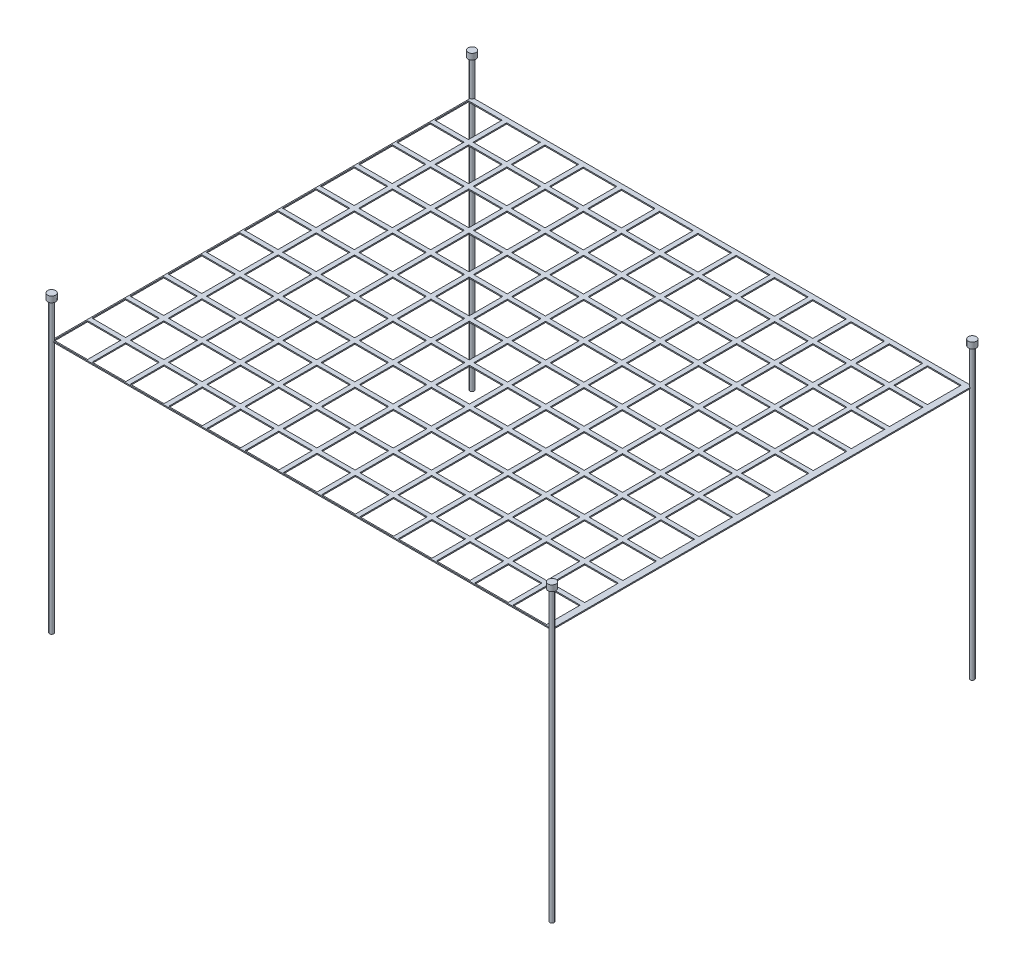
from build123d import *

# Parameters (mm, degrees)
CROQUIS1_W                 = 5950
CROQUIS1_H                 = 5000
SALIENTE_EXTRUIR1_DEPTH    = 13.32
CROQUIS2_W                 = 400
CROQUIS2_H                 = 400
CORTAR_EXTRUIR1_DEPTH      = 34
MATRIZL1_COUNT             = 11
MATRIZL1_PITCH             = 453
MATRIZL2_COPY_1_SKETCH_W   = 400
MATRIZL2_COPY_1_SKETCH_H   = 400
MATRIZL2_COPY_1_DEPTH      = 34
MATRIZL2_COPY_2_SKETCH_W   = 400
MATRIZL2_COPY_2_SKETCH_H   = 400
MATRIZL2_COPY_2_DEPTH      = 34
MATRIZL2_COPY_3_SKETCH_W   = 400
MATRIZL2_COPY_3_SKETCH_H   = 400
MATRIZL2_COPY_3_DEPTH      = 34
MATRIZL2_COPY_4_SKETCH_W   = 400
MATRIZL2_COPY_4_SKETCH_H   = 400
MATRIZL2_COPY_4_DEPTH      = 34
MATRIZL2_COPY_5_SKETCH_W   = 400
MATRIZL2_COPY_5_SKETCH_H   = 400
MATRIZL2_COPY_5_DEPTH      = 34
MATRIZL2_COPY_6_SKETCH_W   = 400
MATRIZL2_COPY_6_SKETCH_H   = 400
MATRIZL2_COPY_6_DEPTH      = 34
MATRIZL2_COPY_7_SKETCH_W   = 400
MATRIZL2_COPY_7_SKETCH_H   = 400
MATRIZL2_COPY_7_DEPTH      = 34
MATRIZL2_COPY_8_SKETCH_W   = 400
MATRIZL2_COPY_8_SKETCH_H   = 400
MATRIZL2_COPY_8_DEPTH      = 34
MATRIZL2_COPY_9_SKETCH_W   = 400
MATRIZL2_COPY_9_SKETCH_H   = 400
MATRIZL2_COPY_9_DEPTH      = 34
MATRIZL2_COPY_10_SKETCH_W  = 400
MATRIZL2_COPY_10_SKETCH_H  = 400
MATRIZL2_COPY_10_DEPTH     = 34
MATRIZL2_COPY_11_SKETCH_W  = 400
MATRIZL2_COPY_11_SKETCH_H  = 400
MATRIZL2_COPY_11_DEPTH     = 34
MATRIZL2_COPY_12_SKETCH_W  = 400
MATRIZL2_COPY_12_SKETCH_H  = 400
MATRIZL2_COPY_12_DEPTH     = 34
MATRIZL2_COPY_13_SKETCH_W  = 400
MATRIZL2_COPY_13_SKETCH_H  = 400
MATRIZL2_COPY_13_DEPTH     = 34
MATRIZL2_COPY_14_SKETCH_W  = 400
MATRIZL2_COPY_14_SKETCH_H  = 400
MATRIZL2_COPY_14_DEPTH     = 34
MATRIZL2_COPY_15_SKETCH_W  = 400
MATRIZL2_COPY_15_SKETCH_H  = 400
MATRIZL2_COPY_15_DEPTH     = 34
MATRIZL2_COPY_16_SKETCH_W  = 400
MATRIZL2_COPY_16_SKETCH_H  = 400
MATRIZL2_COPY_16_DEPTH     = 34
MATRIZL2_COPY_17_SKETCH_W  = 400
MATRIZL2_COPY_17_SKETCH_H  = 400
MATRIZL2_COPY_17_DEPTH     = 34
MATRIZL2_COPY_18_SKETCH_W  = 400
MATRIZL2_COPY_18_SKETCH_H  = 400
MATRIZL2_COPY_18_DEPTH     = 34
MATRIZL2_COPY_19_SKETCH_W  = 400
MATRIZL2_COPY_19_SKETCH_H  = 400
MATRIZL2_COPY_19_DEPTH     = 34
MATRIZL2_COPY_20_SKETCH_W  = 400
MATRIZL2_COPY_20_SKETCH_H  = 400
MATRIZL2_COPY_20_DEPTH     = 34
MATRIZL2_COPY_21_SKETCH_W  = 400
MATRIZL2_COPY_21_SKETCH_H  = 400
MATRIZL2_COPY_21_DEPTH     = 34
MATRIZL2_COPY_22_SKETCH_W  = 400
MATRIZL2_COPY_22_SKETCH_H  = 400
MATRIZL2_COPY_22_DEPTH     = 34
MATRIZL2_COPY_23_SKETCH_W  = 400
MATRIZL2_COPY_23_SKETCH_H  = 400
MATRIZL2_COPY_23_DEPTH     = 34
MATRIZL2_COPY_24_SKETCH_W  = 400
MATRIZL2_COPY_24_SKETCH_H  = 400
MATRIZL2_COPY_24_DEPTH     = 34
MATRIZL2_COPY_25_SKETCH_W  = 400
MATRIZL2_COPY_25_SKETCH_H  = 400
MATRIZL2_COPY_25_DEPTH     = 34
MATRIZL2_COPY_26_SKETCH_W  = 400
MATRIZL2_COPY_26_SKETCH_H  = 400
MATRIZL2_COPY_26_DEPTH     = 34
MATRIZL2_COPY_27_SKETCH_W  = 400
MATRIZL2_COPY_27_SKETCH_H  = 400
MATRIZL2_COPY_27_DEPTH     = 34
MATRIZL2_COPY_28_SKETCH_W  = 400
MATRIZL2_COPY_28_SKETCH_H  = 400
MATRIZL2_COPY_28_DEPTH     = 34
MATRIZL2_COPY_29_SKETCH_W  = 400
MATRIZL2_COPY_29_SKETCH_H  = 400
MATRIZL2_COPY_29_DEPTH     = 34
MATRIZL2_COPY_30_SKETCH_W  = 400
MATRIZL2_COPY_30_SKETCH_H  = 400
MATRIZL2_COPY_30_DEPTH     = 34
MATRIZL2_COPY_31_SKETCH_W  = 400
MATRIZL2_COPY_31_SKETCH_H  = 400
MATRIZL2_COPY_31_DEPTH     = 34
MATRIZL2_COPY_32_SKETCH_W  = 400
MATRIZL2_COPY_32_SKETCH_H  = 400
MATRIZL2_COPY_32_DEPTH     = 34
MATRIZL2_COPY_33_SKETCH_W  = 400
MATRIZL2_COPY_33_SKETCH_H  = 400
MATRIZL2_COPY_33_DEPTH     = 34
MATRIZL2_COPY_34_SKETCH_W  = 400
MATRIZL2_COPY_34_SKETCH_H  = 400
MATRIZL2_COPY_34_DEPTH     = 34
MATRIZL2_COPY_35_SKETCH_W  = 400
MATRIZL2_COPY_35_SKETCH_H  = 400
MATRIZL2_COPY_35_DEPTH     = 34
MATRIZL2_COPY_36_SKETCH_W  = 400
MATRIZL2_COPY_36_SKETCH_H  = 400
MATRIZL2_COPY_36_DEPTH     = 34
MATRIZL2_COPY_37_SKETCH_W  = 400
MATRIZL2_COPY_37_SKETCH_H  = 400
MATRIZL2_COPY_37_DEPTH     = 34
MATRIZL2_COPY_38_SKETCH_W  = 400
MATRIZL2_COPY_38_SKETCH_H  = 400
MATRIZL2_COPY_38_DEPTH     = 34
MATRIZL2_COPY_39_SKETCH_W  = 400
MATRIZL2_COPY_39_SKETCH_H  = 400
MATRIZL2_COPY_39_DEPTH     = 34
MATRIZL2_COPY_40_SKETCH_W  = 400
MATRIZL2_COPY_40_SKETCH_H  = 400
MATRIZL2_COPY_40_DEPTH     = 34
MATRIZL2_COPY_41_SKETCH_W  = 400
MATRIZL2_COPY_41_SKETCH_H  = 400
MATRIZL2_COPY_41_DEPTH     = 34
MATRIZL2_COPY_42_SKETCH_W  = 400
MATRIZL2_COPY_42_SKETCH_H  = 400
MATRIZL2_COPY_42_DEPTH     = 34
MATRIZL2_COPY_43_SKETCH_W  = 400
MATRIZL2_COPY_43_SKETCH_H  = 400
MATRIZL2_COPY_43_DEPTH     = 34
MATRIZL2_COPY_44_SKETCH_W  = 400
MATRIZL2_COPY_44_SKETCH_H  = 400
MATRIZL2_COPY_44_DEPTH     = 34
MATRIZL2_COPY_45_SKETCH_W  = 400
MATRIZL2_COPY_45_SKETCH_H  = 400
MATRIZL2_COPY_45_DEPTH     = 34
MATRIZL2_COPY_46_SKETCH_W  = 400
MATRIZL2_COPY_46_SKETCH_H  = 400
MATRIZL2_COPY_46_DEPTH     = 34
MATRIZL2_COPY_47_SKETCH_W  = 400
MATRIZL2_COPY_47_SKETCH_H  = 400
MATRIZL2_COPY_47_DEPTH     = 34
MATRIZL2_COPY_48_SKETCH_W  = 400
MATRIZL2_COPY_48_SKETCH_H  = 400
MATRIZL2_COPY_48_DEPTH     = 34
MATRIZL2_COPY_49_SKETCH_W  = 400
MATRIZL2_COPY_49_SKETCH_H  = 400
MATRIZL2_COPY_49_DEPTH     = 34
MATRIZL2_COPY_50_SKETCH_W  = 400
MATRIZL2_COPY_50_SKETCH_H  = 400
MATRIZL2_COPY_50_DEPTH     = 34
MATRIZL2_COPY_51_SKETCH_W  = 400
MATRIZL2_COPY_51_SKETCH_H  = 400
MATRIZL2_COPY_51_DEPTH     = 34
MATRIZL2_COPY_52_SKETCH_W  = 400
MATRIZL2_COPY_52_SKETCH_H  = 400
MATRIZL2_COPY_52_DEPTH     = 34
MATRIZL2_COPY_53_SKETCH_W  = 400
MATRIZL2_COPY_53_SKETCH_H  = 400
MATRIZL2_COPY_53_DEPTH     = 34
MATRIZL2_COPY_54_SKETCH_W  = 400
MATRIZL2_COPY_54_SKETCH_H  = 400
MATRIZL2_COPY_54_DEPTH     = 34
MATRIZL2_COPY_55_SKETCH_W  = 400
MATRIZL2_COPY_55_SKETCH_H  = 400
MATRIZL2_COPY_55_DEPTH     = 34
MATRIZL2_COPY_56_SKETCH_W  = 400
MATRIZL2_COPY_56_SKETCH_H  = 400
MATRIZL2_COPY_56_DEPTH     = 34
MATRIZL2_COPY_57_SKETCH_W  = 400
MATRIZL2_COPY_57_SKETCH_H  = 400
MATRIZL2_COPY_57_DEPTH     = 34
MATRIZL2_COPY_58_SKETCH_W  = 400
MATRIZL2_COPY_58_SKETCH_H  = 400
MATRIZL2_COPY_58_DEPTH     = 34
MATRIZL2_COPY_59_SKETCH_W  = 400
MATRIZL2_COPY_59_SKETCH_H  = 400
MATRIZL2_COPY_59_DEPTH     = 34
MATRIZL2_COPY_60_SKETCH_W  = 400
MATRIZL2_COPY_60_SKETCH_H  = 400
MATRIZL2_COPY_60_DEPTH     = 34
MATRIZL2_COPY_61_SKETCH_W  = 400
MATRIZL2_COPY_61_SKETCH_H  = 400
MATRIZL2_COPY_61_DEPTH     = 34
MATRIZL2_COPY_62_SKETCH_W  = 400
MATRIZL2_COPY_62_SKETCH_H  = 400
MATRIZL2_COPY_62_DEPTH     = 34
MATRIZL2_COPY_63_SKETCH_W  = 400
MATRIZL2_COPY_63_SKETCH_H  = 400
MATRIZL2_COPY_63_DEPTH     = 34
MATRIZL2_COPY_64_SKETCH_W  = 400
MATRIZL2_COPY_64_SKETCH_H  = 400
MATRIZL2_COPY_64_DEPTH     = 34
MATRIZL2_COPY_65_SKETCH_W  = 400
MATRIZL2_COPY_65_SKETCH_H  = 400
MATRIZL2_COPY_65_DEPTH     = 34
MATRIZL2_COPY_66_SKETCH_W  = 400
MATRIZL2_COPY_66_SKETCH_H  = 400
MATRIZL2_COPY_66_DEPTH     = 34
MATRIZL2_COPY_67_SKETCH_W  = 400
MATRIZL2_COPY_67_SKETCH_H  = 400
MATRIZL2_COPY_67_DEPTH     = 34
MATRIZL2_COPY_68_SKETCH_W  = 400
MATRIZL2_COPY_68_SKETCH_H  = 400
MATRIZL2_COPY_68_DEPTH     = 34
MATRIZL2_COPY_69_SKETCH_W  = 400
MATRIZL2_COPY_69_SKETCH_H  = 400
MATRIZL2_COPY_69_DEPTH     = 34
MATRIZL2_COPY_70_SKETCH_W  = 400
MATRIZL2_COPY_70_SKETCH_H  = 400
MATRIZL2_COPY_70_DEPTH     = 34
MATRIZL2_COPY_71_SKETCH_W  = 400
MATRIZL2_COPY_71_SKETCH_H  = 400
MATRIZL2_COPY_71_DEPTH     = 34
MATRIZL2_COPY_72_SKETCH_W  = 400
MATRIZL2_COPY_72_SKETCH_H  = 400
MATRIZL2_COPY_72_DEPTH     = 34
MATRIZL2_COPY_73_SKETCH_W  = 400
MATRIZL2_COPY_73_SKETCH_H  = 400
MATRIZL2_COPY_73_DEPTH     = 34
MATRIZL2_COPY_74_SKETCH_W  = 400
MATRIZL2_COPY_74_SKETCH_H  = 400
MATRIZL2_COPY_74_DEPTH     = 34
MATRIZL2_COPY_75_SKETCH_W  = 400
MATRIZL2_COPY_75_SKETCH_H  = 400
MATRIZL2_COPY_75_DEPTH     = 34
MATRIZL2_COPY_76_SKETCH_W  = 400
MATRIZL2_COPY_76_SKETCH_H  = 400
MATRIZL2_COPY_76_DEPTH     = 34
MATRIZL2_COPY_77_SKETCH_W  = 400
MATRIZL2_COPY_77_SKETCH_H  = 400
MATRIZL2_COPY_77_DEPTH     = 34
MATRIZL2_COPY_78_SKETCH_W  = 400
MATRIZL2_COPY_78_SKETCH_H  = 400
MATRIZL2_COPY_78_DEPTH     = 34
MATRIZL2_COPY_79_SKETCH_W  = 400
MATRIZL2_COPY_79_SKETCH_H  = 400
MATRIZL2_COPY_79_DEPTH     = 34
MATRIZL2_COPY_80_SKETCH_W  = 400
MATRIZL2_COPY_80_SKETCH_H  = 400
MATRIZL2_COPY_80_DEPTH     = 34
MATRIZL2_COPY_81_SKETCH_W  = 400
MATRIZL2_COPY_81_SKETCH_H  = 400
MATRIZL2_COPY_81_DEPTH     = 34
MATRIZL2_COPY_82_SKETCH_W  = 400
MATRIZL2_COPY_82_SKETCH_H  = 400
MATRIZL2_COPY_82_DEPTH     = 34
MATRIZL2_COPY_83_SKETCH_W  = 400
MATRIZL2_COPY_83_SKETCH_H  = 400
MATRIZL2_COPY_83_DEPTH     = 34
MATRIZL2_COPY_84_SKETCH_W  = 400
MATRIZL2_COPY_84_SKETCH_H  = 400
MATRIZL2_COPY_84_DEPTH     = 34
MATRIZL2_COPY_85_SKETCH_W  = 400
MATRIZL2_COPY_85_SKETCH_H  = 400
MATRIZL2_COPY_85_DEPTH     = 34
MATRIZL2_COPY_86_SKETCH_W  = 400
MATRIZL2_COPY_86_SKETCH_H  = 400
MATRIZL2_COPY_86_DEPTH     = 34
MATRIZL2_COPY_87_SKETCH_W  = 400
MATRIZL2_COPY_87_SKETCH_H  = 400
MATRIZL2_COPY_87_DEPTH     = 34
MATRIZL2_COPY_88_SKETCH_W  = 400
MATRIZL2_COPY_88_SKETCH_H  = 400
MATRIZL2_COPY_88_DEPTH     = 34
MATRIZL2_COPY_89_SKETCH_W  = 400
MATRIZL2_COPY_89_SKETCH_H  = 400
MATRIZL2_COPY_89_DEPTH     = 34
MATRIZL2_COPY_90_SKETCH_W  = 400
MATRIZL2_COPY_90_SKETCH_H  = 400
MATRIZL2_COPY_90_DEPTH     = 34
MATRIZL2_COPY_91_SKETCH_W  = 400
MATRIZL2_COPY_91_SKETCH_H  = 400
MATRIZL2_COPY_91_DEPTH     = 34
MATRIZL2_COPY_92_SKETCH_W  = 400
MATRIZL2_COPY_92_SKETCH_H  = 400
MATRIZL2_COPY_92_DEPTH     = 34
MATRIZL2_COPY_93_SKETCH_W  = 400
MATRIZL2_COPY_93_SKETCH_H  = 400
MATRIZL2_COPY_93_DEPTH     = 34
MATRIZL2_COPY_94_SKETCH_W  = 400
MATRIZL2_COPY_94_SKETCH_H  = 400
MATRIZL2_COPY_94_DEPTH     = 34
MATRIZL2_COPY_95_SKETCH_W  = 400
MATRIZL2_COPY_95_SKETCH_H  = 400
MATRIZL2_COPY_95_DEPTH     = 34
MATRIZL2_COPY_96_SKETCH_W  = 400
MATRIZL2_COPY_96_SKETCH_H  = 400
MATRIZL2_COPY_96_DEPTH     = 34
MATRIZL2_COPY_97_SKETCH_W  = 400
MATRIZL2_COPY_97_SKETCH_H  = 400
MATRIZL2_COPY_97_DEPTH     = 34
MATRIZL2_COPY_98_SKETCH_W  = 400
MATRIZL2_COPY_98_SKETCH_H  = 400
MATRIZL2_COPY_98_DEPTH     = 34
MATRIZL2_COPY_99_SKETCH_W  = 400
MATRIZL2_COPY_99_SKETCH_H  = 400
MATRIZL2_COPY_99_DEPTH     = 34
MATRIZL2_COPY_100_SKETCH_W = 400
MATRIZL2_COPY_100_SKETCH_H = 400
MATRIZL2_COPY_100_DEPTH    = 34
MATRIZL2_COPY_101_SKETCH_W = 400
MATRIZL2_COPY_101_SKETCH_H = 400
MATRIZL2_COPY_101_DEPTH    = 34
MATRIZL2_COPY_102_SKETCH_W = 400
MATRIZL2_COPY_102_SKETCH_H = 400
MATRIZL2_COPY_102_DEPTH    = 34
MATRIZL2_COPY_103_SKETCH_W = 400
MATRIZL2_COPY_103_SKETCH_H = 400
MATRIZL2_COPY_103_DEPTH    = 34
MATRIZL2_COPY_104_SKETCH_W = 400
MATRIZL2_COPY_104_SKETCH_H = 400
MATRIZL2_COPY_104_DEPTH    = 34
MATRIZL2_COPY_105_SKETCH_W = 400
MATRIZL2_COPY_105_SKETCH_H = 400
MATRIZL2_COPY_105_DEPTH    = 34
MATRIZL2_COPY_106_SKETCH_W = 400
MATRIZL2_COPY_106_SKETCH_H = 400
MATRIZL2_COPY_106_DEPTH    = 34
MATRIZL2_COPY_107_SKETCH_W = 400
MATRIZL2_COPY_107_SKETCH_H = 400
MATRIZL2_COPY_107_DEPTH    = 34
MATRIZL2_COPY_108_SKETCH_W = 400
MATRIZL2_COPY_108_SKETCH_H = 400
MATRIZL2_COPY_108_DEPTH    = 34
MATRIZL2_COPY_109_SKETCH_W = 400
MATRIZL2_COPY_109_SKETCH_H = 400
MATRIZL2_COPY_109_DEPTH    = 34
MATRIZL2_COPY_110_SKETCH_W = 400
MATRIZL2_COPY_110_SKETCH_H = 400
MATRIZL2_COPY_110_DEPTH    = 34
MATRIZL2_COPY_111_SKETCH_W = 400
MATRIZL2_COPY_111_SKETCH_H = 400
MATRIZL2_COPY_111_DEPTH    = 34
MATRIZL2_COPY_112_SKETCH_W = 400
MATRIZL2_COPY_112_SKETCH_H = 400
MATRIZL2_COPY_112_DEPTH    = 34
MATRIZL2_COPY_113_SKETCH_W = 400
MATRIZL2_COPY_113_SKETCH_H = 400
MATRIZL2_COPY_113_DEPTH    = 34
MATRIZL2_COPY_114_SKETCH_W = 400
MATRIZL2_COPY_114_SKETCH_H = 400
MATRIZL2_COPY_114_DEPTH    = 34
MATRIZL2_COPY_115_SKETCH_W = 400
MATRIZL2_COPY_115_SKETCH_H = 400
MATRIZL2_COPY_115_DEPTH    = 34
MATRIZL2_COPY_116_SKETCH_W = 400
MATRIZL2_COPY_116_SKETCH_H = 400
MATRIZL2_COPY_116_DEPTH    = 34
MATRIZL2_COPY_117_SKETCH_W = 400
MATRIZL2_COPY_117_SKETCH_H = 400
MATRIZL2_COPY_117_DEPTH    = 34
MATRIZL2_COPY_118_SKETCH_W = 400
MATRIZL2_COPY_118_SKETCH_H = 400
MATRIZL2_COPY_118_DEPTH    = 34
MATRIZL2_COPY_119_SKETCH_W = 400
MATRIZL2_COPY_119_SKETCH_H = 400
MATRIZL2_COPY_119_DEPTH    = 34
MATRIZL2_COPY_120_SKETCH_W = 400
MATRIZL2_COPY_120_SKETCH_H = 400
MATRIZL2_COPY_120_DEPTH    = 34
MATRIZL2_COPY_121_SKETCH_W = 400
MATRIZL2_COPY_121_SKETCH_H = 400
MATRIZL2_COPY_121_DEPTH    = 34
MATRIZL2_COPY_122_SKETCH_W = 400
MATRIZL2_COPY_122_SKETCH_H = 400
MATRIZL2_COPY_122_DEPTH    = 34
MATRIZL2_COPY_123_SKETCH_W = 400
MATRIZL2_COPY_123_SKETCH_H = 400
MATRIZL2_COPY_123_DEPTH    = 34
MATRIZL2_COPY_124_SKETCH_W = 400
MATRIZL2_COPY_124_SKETCH_H = 400
MATRIZL2_COPY_124_DEPTH    = 34
MATRIZL2_COPY_125_SKETCH_W = 400
MATRIZL2_COPY_125_SKETCH_H = 400
MATRIZL2_COPY_125_DEPTH    = 34
MATRIZL2_COPY_126_SKETCH_W = 400
MATRIZL2_COPY_126_SKETCH_H = 400
MATRIZL2_COPY_126_DEPTH    = 34
MATRIZL2_COPY_127_SKETCH_W = 400
MATRIZL2_COPY_127_SKETCH_H = 400
MATRIZL2_COPY_127_DEPTH    = 34
MATRIZL2_COPY_128_SKETCH_W = 400
MATRIZL2_COPY_128_SKETCH_H = 400
MATRIZL2_COPY_128_DEPTH    = 34
MATRIZL2_COPY_129_SKETCH_W = 400
MATRIZL2_COPY_129_SKETCH_H = 400
MATRIZL2_COPY_129_DEPTH    = 34
MATRIZL2_COPY_130_SKETCH_W = 400
MATRIZL2_COPY_130_SKETCH_H = 400
MATRIZL2_COPY_130_DEPTH    = 34
MATRIZL2_COPY_131_SKETCH_W = 400
MATRIZL2_COPY_131_SKETCH_H = 400
MATRIZL2_COPY_131_DEPTH    = 34
MATRIZL2_COPY_132_SKETCH_W = 400
MATRIZL2_COPY_132_SKETCH_H = 400
MATRIZL2_COPY_132_DEPTH    = 34
CROQUIS3_R                 = 25
SALIENTE_EXTRUIR2_DEPTH    = 3500
CROQUIS4_R                 = 47.56913301
SALIENTE_EXTRUIR3_DEPTH    = 70
MATRIZL3_COUNT             = 2
MATRIZL3_PITCH             = 5000
MATRIZL4_COPY_1_SKETCH_R   = 25
MATRIZL4_COPY_1_DEPTH      = 3500
MATRIZL4_COPY_2_SKETCH_R   = 47.56913301
MATRIZL4_COPY_2_DEPTH      = 70
MATRIZL4_COPY_3_SKETCH_R   = 25
MATRIZL4_COPY_3_DEPTH      = 3500
MATRIZL4_COPY_4_SKETCH_R   = 47.56913301
MATRIZL4_COPY_4_DEPTH      = 70


with BuildPart() as part:
    # Croquis1 → Saliente-Extruir1 (new body)
    with BuildSketch(Plane(origin=(0, 0, 0), x_dir=(1, 0, 0), z_dir=(0, 1, 0))):
        Rectangle(CROQUIS1_W, CROQUIS1_H)
    extrude(amount=SALIENTE_EXTRUIR1_DEPTH)

    # Croquis2 → Cortar-Extruir1 (cut)
    with BuildSketch(Plane(origin=(0, 13.32, 0), x_dir=(1, 0, 0), z_dir=(0, 1, 0))):
        with Locations((-2761.68, -2286.68)):
            Rectangle(CROQUIS2_W, CROQUIS2_H)
    cortar_extruir1 = extrude(amount=-CORTAR_EXTRUIR1_DEPTH, mode=Mode.SUBTRACT)

    # MatrizL1: Cortar-Extruir1 ×11
    with Locations(*[(0, 0, -i * MATRIZL1_PITCH) for i in range(1, MATRIZL1_COUNT)]):
        add(cortar_extruir1, mode=Mode.SUBTRACT)

    # MatrizL2 copy 1 sketch → MatrizL2 copy 1 (cut)
    with BuildSketch(Plane(origin=(455, 13.32, -453), x_dir=(1, 0, 0), z_dir=(0, 1, 0))):
        with Locations((-2761.68, -2286.68)):
            Rectangle(MATRIZL2_COPY_1_SKETCH_W, MATRIZL2_COPY_1_SKETCH_H)
    extrude(amount=-MATRIZL2_COPY_1_DEPTH, mode=Mode.SUBTRACT)

    # MatrizL2 copy 2 sketch → MatrizL2 copy 2 (cut)
    with BuildSketch(Plane(origin=(910, 13.32, -453), x_dir=(1, 0, 0), z_dir=(0, 1, 0))):
        with Locations((-2761.68, -2286.68)):
            Rectangle(MATRIZL2_COPY_2_SKETCH_W, MATRIZL2_COPY_2_SKETCH_H)
    extrude(amount=-MATRIZL2_COPY_2_DEPTH, mode=Mode.SUBTRACT)

    # MatrizL2 copy 3 sketch → MatrizL2 copy 3 (cut)
    with BuildSketch(Plane(origin=(1365, 13.32, -453), x_dir=(1, 0, 0), z_dir=(0, 1, 0))):
        with Locations((-2761.68, -2286.68)):
            Rectangle(MATRIZL2_COPY_3_SKETCH_W, MATRIZL2_COPY_3_SKETCH_H)
    extrude(amount=-MATRIZL2_COPY_3_DEPTH, mode=Mode.SUBTRACT)

    # MatrizL2 copy 4 sketch → MatrizL2 copy 4 (cut)
    with BuildSketch(Plane(origin=(1820, 13.32, -453), x_dir=(1, 0, 0), z_dir=(0, 1, 0))):
        with Locations((-2761.68, -2286.68)):
            Rectangle(MATRIZL2_COPY_4_SKETCH_W, MATRIZL2_COPY_4_SKETCH_H)
    extrude(amount=-MATRIZL2_COPY_4_DEPTH, mode=Mode.SUBTRACT)

    # MatrizL2 copy 5 sketch → MatrizL2 copy 5 (cut)
    with BuildSketch(Plane(origin=(2275, 13.32, -453), x_dir=(1, 0, 0), z_dir=(0, 1, 0))):
        with Locations((-2761.68, -2286.68)):
            Rectangle(MATRIZL2_COPY_5_SKETCH_W, MATRIZL2_COPY_5_SKETCH_H)
    extrude(amount=-MATRIZL2_COPY_5_DEPTH, mode=Mode.SUBTRACT)

    # MatrizL2 copy 6 sketch → MatrizL2 copy 6 (cut)
    with BuildSketch(Plane(origin=(2730, 13.32, -453), x_dir=(1, 0, 0), z_dir=(0, 1, 0))):
        with Locations((-2761.68, -2286.68)):
            Rectangle(MATRIZL2_COPY_6_SKETCH_W, MATRIZL2_COPY_6_SKETCH_H)
    extrude(amount=-MATRIZL2_COPY_6_DEPTH, mode=Mode.SUBTRACT)

    # MatrizL2 copy 7 sketch → MatrizL2 copy 7 (cut)
    with BuildSketch(Plane(origin=(3185, 13.32, -453), x_dir=(1, 0, 0), z_dir=(0, 1, 0))):
        with Locations((-2761.68, -2286.68)):
            Rectangle(MATRIZL2_COPY_7_SKETCH_W, MATRIZL2_COPY_7_SKETCH_H)
    extrude(amount=-MATRIZL2_COPY_7_DEPTH, mode=Mode.SUBTRACT)

    # MatrizL2 copy 8 sketch → MatrizL2 copy 8 (cut)
    with BuildSketch(Plane(origin=(3640, 13.32, -453), x_dir=(1, 0, 0), z_dir=(0, 1, 0))):
        with Locations((-2761.68, -2286.68)):
            Rectangle(MATRIZL2_COPY_8_SKETCH_W, MATRIZL2_COPY_8_SKETCH_H)
    extrude(amount=-MATRIZL2_COPY_8_DEPTH, mode=Mode.SUBTRACT)

    # MatrizL2 copy 9 sketch → MatrizL2 copy 9 (cut)
    with BuildSketch(Plane(origin=(4095, 13.32, -453), x_dir=(1, 0, 0), z_dir=(0, 1, 0))):
        with Locations((-2761.68, -2286.68)):
            Rectangle(MATRIZL2_COPY_9_SKETCH_W, MATRIZL2_COPY_9_SKETCH_H)
    extrude(amount=-MATRIZL2_COPY_9_DEPTH, mode=Mode.SUBTRACT)

    # MatrizL2 copy 10 sketch → MatrizL2 copy 10 (cut)
    with BuildSketch(Plane(origin=(4550, 13.32, -453), x_dir=(1, 0, 0), z_dir=(0, 1, 0))):
        with Locations((-2761.68, -2286.68)):
            Rectangle(MATRIZL2_COPY_10_SKETCH_W, MATRIZL2_COPY_10_SKETCH_H)
    extrude(amount=-MATRIZL2_COPY_10_DEPTH, mode=Mode.SUBTRACT)

    # MatrizL2 copy 11 sketch → MatrizL2 copy 11 (cut)
    with BuildSketch(Plane(origin=(5005, 13.32, -453), x_dir=(1, 0, 0), z_dir=(0, 1, 0))):
        with Locations((-2761.68, -2286.68)):
            Rectangle(MATRIZL2_COPY_11_SKETCH_W, MATRIZL2_COPY_11_SKETCH_H)
    extrude(amount=-MATRIZL2_COPY_11_DEPTH, mode=Mode.SUBTRACT)

    # MatrizL2 copy 12 sketch → MatrizL2 copy 12 (cut)
    with BuildSketch(Plane(origin=(5460, 13.32, -453), x_dir=(1, 0, 0), z_dir=(0, 1, 0))):
        with Locations((-2761.68, -2286.68)):
            Rectangle(MATRIZL2_COPY_12_SKETCH_W, MATRIZL2_COPY_12_SKETCH_H)
    extrude(amount=-MATRIZL2_COPY_12_DEPTH, mode=Mode.SUBTRACT)

    # MatrizL2 copy 13 sketch → MatrizL2 copy 13 (cut)
    with BuildSketch(Plane(origin=(455, 13.32, -906), x_dir=(1, 0, 0), z_dir=(0, 1, 0))):
        with Locations((-2761.68, -2286.68)):
            Rectangle(MATRIZL2_COPY_13_SKETCH_W, MATRIZL2_COPY_13_SKETCH_H)
    extrude(amount=-MATRIZL2_COPY_13_DEPTH, mode=Mode.SUBTRACT)

    # MatrizL2 copy 14 sketch → MatrizL2 copy 14 (cut)
    with BuildSketch(Plane(origin=(910, 13.32, -906), x_dir=(1, 0, 0), z_dir=(0, 1, 0))):
        with Locations((-2761.68, -2286.68)):
            Rectangle(MATRIZL2_COPY_14_SKETCH_W, MATRIZL2_COPY_14_SKETCH_H)
    extrude(amount=-MATRIZL2_COPY_14_DEPTH, mode=Mode.SUBTRACT)

    # MatrizL2 copy 15 sketch → MatrizL2 copy 15 (cut)
    with BuildSketch(Plane(origin=(1365, 13.32, -906), x_dir=(1, 0, 0), z_dir=(0, 1, 0))):
        with Locations((-2761.68, -2286.68)):
            Rectangle(MATRIZL2_COPY_15_SKETCH_W, MATRIZL2_COPY_15_SKETCH_H)
    extrude(amount=-MATRIZL2_COPY_15_DEPTH, mode=Mode.SUBTRACT)

    # MatrizL2 copy 16 sketch → MatrizL2 copy 16 (cut)
    with BuildSketch(Plane(origin=(1820, 13.32, -906), x_dir=(1, 0, 0), z_dir=(0, 1, 0))):
        with Locations((-2761.68, -2286.68)):
            Rectangle(MATRIZL2_COPY_16_SKETCH_W, MATRIZL2_COPY_16_SKETCH_H)
    extrude(amount=-MATRIZL2_COPY_16_DEPTH, mode=Mode.SUBTRACT)

    # MatrizL2 copy 17 sketch → MatrizL2 copy 17 (cut)
    with BuildSketch(Plane(origin=(2275, 13.32, -906), x_dir=(1, 0, 0), z_dir=(0, 1, 0))):
        with Locations((-2761.68, -2286.68)):
            Rectangle(MATRIZL2_COPY_17_SKETCH_W, MATRIZL2_COPY_17_SKETCH_H)
    extrude(amount=-MATRIZL2_COPY_17_DEPTH, mode=Mode.SUBTRACT)

    # MatrizL2 copy 18 sketch → MatrizL2 copy 18 (cut)
    with BuildSketch(Plane(origin=(2730, 13.32, -906), x_dir=(1, 0, 0), z_dir=(0, 1, 0))):
        with Locations((-2761.68, -2286.68)):
            Rectangle(MATRIZL2_COPY_18_SKETCH_W, MATRIZL2_COPY_18_SKETCH_H)
    extrude(amount=-MATRIZL2_COPY_18_DEPTH, mode=Mode.SUBTRACT)

    # MatrizL2 copy 19 sketch → MatrizL2 copy 19 (cut)
    with BuildSketch(Plane(origin=(3185, 13.32, -906), x_dir=(1, 0, 0), z_dir=(0, 1, 0))):
        with Locations((-2761.68, -2286.68)):
            Rectangle(MATRIZL2_COPY_19_SKETCH_W, MATRIZL2_COPY_19_SKETCH_H)
    extrude(amount=-MATRIZL2_COPY_19_DEPTH, mode=Mode.SUBTRACT)

    # MatrizL2 copy 20 sketch → MatrizL2 copy 20 (cut)
    with BuildSketch(Plane(origin=(3640, 13.32, -906), x_dir=(1, 0, 0), z_dir=(0, 1, 0))):
        with Locations((-2761.68, -2286.68)):
            Rectangle(MATRIZL2_COPY_20_SKETCH_W, MATRIZL2_COPY_20_SKETCH_H)
    extrude(amount=-MATRIZL2_COPY_20_DEPTH, mode=Mode.SUBTRACT)

    # MatrizL2 copy 21 sketch → MatrizL2 copy 21 (cut)
    with BuildSketch(Plane(origin=(4095, 13.32, -906), x_dir=(1, 0, 0), z_dir=(0, 1, 0))):
        with Locations((-2761.68, -2286.68)):
            Rectangle(MATRIZL2_COPY_21_SKETCH_W, MATRIZL2_COPY_21_SKETCH_H)
    extrude(amount=-MATRIZL2_COPY_21_DEPTH, mode=Mode.SUBTRACT)

    # MatrizL2 copy 22 sketch → MatrizL2 copy 22 (cut)
    with BuildSketch(Plane(origin=(4550, 13.32, -906), x_dir=(1, 0, 0), z_dir=(0, 1, 0))):
        with Locations((-2761.68, -2286.68)):
            Rectangle(MATRIZL2_COPY_22_SKETCH_W, MATRIZL2_COPY_22_SKETCH_H)
    extrude(amount=-MATRIZL2_COPY_22_DEPTH, mode=Mode.SUBTRACT)

    # MatrizL2 copy 23 sketch → MatrizL2 copy 23 (cut)
    with BuildSketch(Plane(origin=(5005, 13.32, -906), x_dir=(1, 0, 0), z_dir=(0, 1, 0))):
        with Locations((-2761.68, -2286.68)):
            Rectangle(MATRIZL2_COPY_23_SKETCH_W, MATRIZL2_COPY_23_SKETCH_H)
    extrude(amount=-MATRIZL2_COPY_23_DEPTH, mode=Mode.SUBTRACT)

    # MatrizL2 copy 24 sketch → MatrizL2 copy 24 (cut)
    with BuildSketch(Plane(origin=(5460, 13.32, -906), x_dir=(1, 0, 0), z_dir=(0, 1, 0))):
        with Locations((-2761.68, -2286.68)):
            Rectangle(MATRIZL2_COPY_24_SKETCH_W, MATRIZL2_COPY_24_SKETCH_H)
    extrude(amount=-MATRIZL2_COPY_24_DEPTH, mode=Mode.SUBTRACT)

    # MatrizL2 copy 25 sketch → MatrizL2 copy 25 (cut)
    with BuildSketch(Plane(origin=(455, 13.32, -1359), x_dir=(1, 0, 0), z_dir=(0, 1, 0))):
        with Locations((-2761.68, -2286.68)):
            Rectangle(MATRIZL2_COPY_25_SKETCH_W, MATRIZL2_COPY_25_SKETCH_H)
    extrude(amount=-MATRIZL2_COPY_25_DEPTH, mode=Mode.SUBTRACT)

    # MatrizL2 copy 26 sketch → MatrizL2 copy 26 (cut)
    with BuildSketch(Plane(origin=(910, 13.32, -1359), x_dir=(1, 0, 0), z_dir=(0, 1, 0))):
        with Locations((-2761.68, -2286.68)):
            Rectangle(MATRIZL2_COPY_26_SKETCH_W, MATRIZL2_COPY_26_SKETCH_H)
    extrude(amount=-MATRIZL2_COPY_26_DEPTH, mode=Mode.SUBTRACT)

    # MatrizL2 copy 27 sketch → MatrizL2 copy 27 (cut)
    with BuildSketch(Plane(origin=(1365, 13.32, -1359), x_dir=(1, 0, 0), z_dir=(0, 1, 0))):
        with Locations((-2761.68, -2286.68)):
            Rectangle(MATRIZL2_COPY_27_SKETCH_W, MATRIZL2_COPY_27_SKETCH_H)
    extrude(amount=-MATRIZL2_COPY_27_DEPTH, mode=Mode.SUBTRACT)

    # MatrizL2 copy 28 sketch → MatrizL2 copy 28 (cut)
    with BuildSketch(Plane(origin=(1820, 13.32, -1359), x_dir=(1, 0, 0), z_dir=(0, 1, 0))):
        with Locations((-2761.68, -2286.68)):
            Rectangle(MATRIZL2_COPY_28_SKETCH_W, MATRIZL2_COPY_28_SKETCH_H)
    extrude(amount=-MATRIZL2_COPY_28_DEPTH, mode=Mode.SUBTRACT)

    # MatrizL2 copy 29 sketch → MatrizL2 copy 29 (cut)
    with BuildSketch(Plane(origin=(2275, 13.32, -1359), x_dir=(1, 0, 0), z_dir=(0, 1, 0))):
        with Locations((-2761.68, -2286.68)):
            Rectangle(MATRIZL2_COPY_29_SKETCH_W, MATRIZL2_COPY_29_SKETCH_H)
    extrude(amount=-MATRIZL2_COPY_29_DEPTH, mode=Mode.SUBTRACT)

    # MatrizL2 copy 30 sketch → MatrizL2 copy 30 (cut)
    with BuildSketch(Plane(origin=(2730, 13.32, -1359), x_dir=(1, 0, 0), z_dir=(0, 1, 0))):
        with Locations((-2761.68, -2286.68)):
            Rectangle(MATRIZL2_COPY_30_SKETCH_W, MATRIZL2_COPY_30_SKETCH_H)
    extrude(amount=-MATRIZL2_COPY_30_DEPTH, mode=Mode.SUBTRACT)

    # MatrizL2 copy 31 sketch → MatrizL2 copy 31 (cut)
    with BuildSketch(Plane(origin=(3185, 13.32, -1359), x_dir=(1, 0, 0), z_dir=(0, 1, 0))):
        with Locations((-2761.68, -2286.68)):
            Rectangle(MATRIZL2_COPY_31_SKETCH_W, MATRIZL2_COPY_31_SKETCH_H)
    extrude(amount=-MATRIZL2_COPY_31_DEPTH, mode=Mode.SUBTRACT)

    # MatrizL2 copy 32 sketch → MatrizL2 copy 32 (cut)
    with BuildSketch(Plane(origin=(3640, 13.32, -1359), x_dir=(1, 0, 0), z_dir=(0, 1, 0))):
        with Locations((-2761.68, -2286.68)):
            Rectangle(MATRIZL2_COPY_32_SKETCH_W, MATRIZL2_COPY_32_SKETCH_H)
    extrude(amount=-MATRIZL2_COPY_32_DEPTH, mode=Mode.SUBTRACT)

    # MatrizL2 copy 33 sketch → MatrizL2 copy 33 (cut)
    with BuildSketch(Plane(origin=(4095, 13.32, -1359), x_dir=(1, 0, 0), z_dir=(0, 1, 0))):
        with Locations((-2761.68, -2286.68)):
            Rectangle(MATRIZL2_COPY_33_SKETCH_W, MATRIZL2_COPY_33_SKETCH_H)
    extrude(amount=-MATRIZL2_COPY_33_DEPTH, mode=Mode.SUBTRACT)

    # MatrizL2 copy 34 sketch → MatrizL2 copy 34 (cut)
    with BuildSketch(Plane(origin=(4550, 13.32, -1359), x_dir=(1, 0, 0), z_dir=(0, 1, 0))):
        with Locations((-2761.68, -2286.68)):
            Rectangle(MATRIZL2_COPY_34_SKETCH_W, MATRIZL2_COPY_34_SKETCH_H)
    extrude(amount=-MATRIZL2_COPY_34_DEPTH, mode=Mode.SUBTRACT)

    # MatrizL2 copy 35 sketch → MatrizL2 copy 35 (cut)
    with BuildSketch(Plane(origin=(5005, 13.32, -1359), x_dir=(1, 0, 0), z_dir=(0, 1, 0))):
        with Locations((-2761.68, -2286.68)):
            Rectangle(MATRIZL2_COPY_35_SKETCH_W, MATRIZL2_COPY_35_SKETCH_H)
    extrude(amount=-MATRIZL2_COPY_35_DEPTH, mode=Mode.SUBTRACT)

    # MatrizL2 copy 36 sketch → MatrizL2 copy 36 (cut)
    with BuildSketch(Plane(origin=(5460, 13.32, -1359), x_dir=(1, 0, 0), z_dir=(0, 1, 0))):
        with Locations((-2761.68, -2286.68)):
            Rectangle(MATRIZL2_COPY_36_SKETCH_W, MATRIZL2_COPY_36_SKETCH_H)
    extrude(amount=-MATRIZL2_COPY_36_DEPTH, mode=Mode.SUBTRACT)

    # MatrizL2 copy 37 sketch → MatrizL2 copy 37 (cut)
    with BuildSketch(Plane(origin=(455, 13.32, -1812), x_dir=(1, 0, 0), z_dir=(0, 1, 0))):
        with Locations((-2761.68, -2286.68)):
            Rectangle(MATRIZL2_COPY_37_SKETCH_W, MATRIZL2_COPY_37_SKETCH_H)
    extrude(amount=-MATRIZL2_COPY_37_DEPTH, mode=Mode.SUBTRACT)

    # MatrizL2 copy 38 sketch → MatrizL2 copy 38 (cut)
    with BuildSketch(Plane(origin=(910, 13.32, -1812), x_dir=(1, 0, 0), z_dir=(0, 1, 0))):
        with Locations((-2761.68, -2286.68)):
            Rectangle(MATRIZL2_COPY_38_SKETCH_W, MATRIZL2_COPY_38_SKETCH_H)
    extrude(amount=-MATRIZL2_COPY_38_DEPTH, mode=Mode.SUBTRACT)

    # MatrizL2 copy 39 sketch → MatrizL2 copy 39 (cut)
    with BuildSketch(Plane(origin=(1365, 13.32, -1812), x_dir=(1, 0, 0), z_dir=(0, 1, 0))):
        with Locations((-2761.68, -2286.68)):
            Rectangle(MATRIZL2_COPY_39_SKETCH_W, MATRIZL2_COPY_39_SKETCH_H)
    extrude(amount=-MATRIZL2_COPY_39_DEPTH, mode=Mode.SUBTRACT)

    # MatrizL2 copy 40 sketch → MatrizL2 copy 40 (cut)
    with BuildSketch(Plane(origin=(1820, 13.32, -1812), x_dir=(1, 0, 0), z_dir=(0, 1, 0))):
        with Locations((-2761.68, -2286.68)):
            Rectangle(MATRIZL2_COPY_40_SKETCH_W, MATRIZL2_COPY_40_SKETCH_H)
    extrude(amount=-MATRIZL2_COPY_40_DEPTH, mode=Mode.SUBTRACT)

    # MatrizL2 copy 41 sketch → MatrizL2 copy 41 (cut)
    with BuildSketch(Plane(origin=(2275, 13.32, -1812), x_dir=(1, 0, 0), z_dir=(0, 1, 0))):
        with Locations((-2761.68, -2286.68)):
            Rectangle(MATRIZL2_COPY_41_SKETCH_W, MATRIZL2_COPY_41_SKETCH_H)
    extrude(amount=-MATRIZL2_COPY_41_DEPTH, mode=Mode.SUBTRACT)

    # MatrizL2 copy 42 sketch → MatrizL2 copy 42 (cut)
    with BuildSketch(Plane(origin=(2730, 13.32, -1812), x_dir=(1, 0, 0), z_dir=(0, 1, 0))):
        with Locations((-2761.68, -2286.68)):
            Rectangle(MATRIZL2_COPY_42_SKETCH_W, MATRIZL2_COPY_42_SKETCH_H)
    extrude(amount=-MATRIZL2_COPY_42_DEPTH, mode=Mode.SUBTRACT)

    # MatrizL2 copy 43 sketch → MatrizL2 copy 43 (cut)
    with BuildSketch(Plane(origin=(3185, 13.32, -1812), x_dir=(1, 0, 0), z_dir=(0, 1, 0))):
        with Locations((-2761.68, -2286.68)):
            Rectangle(MATRIZL2_COPY_43_SKETCH_W, MATRIZL2_COPY_43_SKETCH_H)
    extrude(amount=-MATRIZL2_COPY_43_DEPTH, mode=Mode.SUBTRACT)

    # MatrizL2 copy 44 sketch → MatrizL2 copy 44 (cut)
    with BuildSketch(Plane(origin=(3640, 13.32, -1812), x_dir=(1, 0, 0), z_dir=(0, 1, 0))):
        with Locations((-2761.68, -2286.68)):
            Rectangle(MATRIZL2_COPY_44_SKETCH_W, MATRIZL2_COPY_44_SKETCH_H)
    extrude(amount=-MATRIZL2_COPY_44_DEPTH, mode=Mode.SUBTRACT)

    # MatrizL2 copy 45 sketch → MatrizL2 copy 45 (cut)
    with BuildSketch(Plane(origin=(4095, 13.32, -1812), x_dir=(1, 0, 0), z_dir=(0, 1, 0))):
        with Locations((-2761.68, -2286.68)):
            Rectangle(MATRIZL2_COPY_45_SKETCH_W, MATRIZL2_COPY_45_SKETCH_H)
    extrude(amount=-MATRIZL2_COPY_45_DEPTH, mode=Mode.SUBTRACT)

    # MatrizL2 copy 46 sketch → MatrizL2 copy 46 (cut)
    with BuildSketch(Plane(origin=(4550, 13.32, -1812), x_dir=(1, 0, 0), z_dir=(0, 1, 0))):
        with Locations((-2761.68, -2286.68)):
            Rectangle(MATRIZL2_COPY_46_SKETCH_W, MATRIZL2_COPY_46_SKETCH_H)
    extrude(amount=-MATRIZL2_COPY_46_DEPTH, mode=Mode.SUBTRACT)

    # MatrizL2 copy 47 sketch → MatrizL2 copy 47 (cut)
    with BuildSketch(Plane(origin=(5005, 13.32, -1812), x_dir=(1, 0, 0), z_dir=(0, 1, 0))):
        with Locations((-2761.68, -2286.68)):
            Rectangle(MATRIZL2_COPY_47_SKETCH_W, MATRIZL2_COPY_47_SKETCH_H)
    extrude(amount=-MATRIZL2_COPY_47_DEPTH, mode=Mode.SUBTRACT)

    # MatrizL2 copy 48 sketch → MatrizL2 copy 48 (cut)
    with BuildSketch(Plane(origin=(5460, 13.32, -1812), x_dir=(1, 0, 0), z_dir=(0, 1, 0))):
        with Locations((-2761.68, -2286.68)):
            Rectangle(MATRIZL2_COPY_48_SKETCH_W, MATRIZL2_COPY_48_SKETCH_H)
    extrude(amount=-MATRIZL2_COPY_48_DEPTH, mode=Mode.SUBTRACT)

    # MatrizL2 copy 49 sketch → MatrizL2 copy 49 (cut)
    with BuildSketch(Plane(origin=(455, 13.32, -2265), x_dir=(1, 0, 0), z_dir=(0, 1, 0))):
        with Locations((-2761.68, -2286.68)):
            Rectangle(MATRIZL2_COPY_49_SKETCH_W, MATRIZL2_COPY_49_SKETCH_H)
    extrude(amount=-MATRIZL2_COPY_49_DEPTH, mode=Mode.SUBTRACT)

    # MatrizL2 copy 50 sketch → MatrizL2 copy 50 (cut)
    with BuildSketch(Plane(origin=(910, 13.32, -2265), x_dir=(1, 0, 0), z_dir=(0, 1, 0))):
        with Locations((-2761.68, -2286.68)):
            Rectangle(MATRIZL2_COPY_50_SKETCH_W, MATRIZL2_COPY_50_SKETCH_H)
    extrude(amount=-MATRIZL2_COPY_50_DEPTH, mode=Mode.SUBTRACT)

    # MatrizL2 copy 51 sketch → MatrizL2 copy 51 (cut)
    with BuildSketch(Plane(origin=(1365, 13.32, -2265), x_dir=(1, 0, 0), z_dir=(0, 1, 0))):
        with Locations((-2761.68, -2286.68)):
            Rectangle(MATRIZL2_COPY_51_SKETCH_W, MATRIZL2_COPY_51_SKETCH_H)
    extrude(amount=-MATRIZL2_COPY_51_DEPTH, mode=Mode.SUBTRACT)

    # MatrizL2 copy 52 sketch → MatrizL2 copy 52 (cut)
    with BuildSketch(Plane(origin=(1820, 13.32, -2265), x_dir=(1, 0, 0), z_dir=(0, 1, 0))):
        with Locations((-2761.68, -2286.68)):
            Rectangle(MATRIZL2_COPY_52_SKETCH_W, MATRIZL2_COPY_52_SKETCH_H)
    extrude(amount=-MATRIZL2_COPY_52_DEPTH, mode=Mode.SUBTRACT)

    # MatrizL2 copy 53 sketch → MatrizL2 copy 53 (cut)
    with BuildSketch(Plane(origin=(2275, 13.32, -2265), x_dir=(1, 0, 0), z_dir=(0, 1, 0))):
        with Locations((-2761.68, -2286.68)):
            Rectangle(MATRIZL2_COPY_53_SKETCH_W, MATRIZL2_COPY_53_SKETCH_H)
    extrude(amount=-MATRIZL2_COPY_53_DEPTH, mode=Mode.SUBTRACT)

    # MatrizL2 copy 54 sketch → MatrizL2 copy 54 (cut)
    with BuildSketch(Plane(origin=(2730, 13.32, -2265), x_dir=(1, 0, 0), z_dir=(0, 1, 0))):
        with Locations((-2761.68, -2286.68)):
            Rectangle(MATRIZL2_COPY_54_SKETCH_W, MATRIZL2_COPY_54_SKETCH_H)
    extrude(amount=-MATRIZL2_COPY_54_DEPTH, mode=Mode.SUBTRACT)

    # MatrizL2 copy 55 sketch → MatrizL2 copy 55 (cut)
    with BuildSketch(Plane(origin=(3185, 13.32, -2265), x_dir=(1, 0, 0), z_dir=(0, 1, 0))):
        with Locations((-2761.68, -2286.68)):
            Rectangle(MATRIZL2_COPY_55_SKETCH_W, MATRIZL2_COPY_55_SKETCH_H)
    extrude(amount=-MATRIZL2_COPY_55_DEPTH, mode=Mode.SUBTRACT)

    # MatrizL2 copy 56 sketch → MatrizL2 copy 56 (cut)
    with BuildSketch(Plane(origin=(3640, 13.32, -2265), x_dir=(1, 0, 0), z_dir=(0, 1, 0))):
        with Locations((-2761.68, -2286.68)):
            Rectangle(MATRIZL2_COPY_56_SKETCH_W, MATRIZL2_COPY_56_SKETCH_H)
    extrude(amount=-MATRIZL2_COPY_56_DEPTH, mode=Mode.SUBTRACT)

    # MatrizL2 copy 57 sketch → MatrizL2 copy 57 (cut)
    with BuildSketch(Plane(origin=(4095, 13.32, -2265), x_dir=(1, 0, 0), z_dir=(0, 1, 0))):
        with Locations((-2761.68, -2286.68)):
            Rectangle(MATRIZL2_COPY_57_SKETCH_W, MATRIZL2_COPY_57_SKETCH_H)
    extrude(amount=-MATRIZL2_COPY_57_DEPTH, mode=Mode.SUBTRACT)

    # MatrizL2 copy 58 sketch → MatrizL2 copy 58 (cut)
    with BuildSketch(Plane(origin=(4550, 13.32, -2265), x_dir=(1, 0, 0), z_dir=(0, 1, 0))):
        with Locations((-2761.68, -2286.68)):
            Rectangle(MATRIZL2_COPY_58_SKETCH_W, MATRIZL2_COPY_58_SKETCH_H)
    extrude(amount=-MATRIZL2_COPY_58_DEPTH, mode=Mode.SUBTRACT)

    # MatrizL2 copy 59 sketch → MatrizL2 copy 59 (cut)
    with BuildSketch(Plane(origin=(5005, 13.32, -2265), x_dir=(1, 0, 0), z_dir=(0, 1, 0))):
        with Locations((-2761.68, -2286.68)):
            Rectangle(MATRIZL2_COPY_59_SKETCH_W, MATRIZL2_COPY_59_SKETCH_H)
    extrude(amount=-MATRIZL2_COPY_59_DEPTH, mode=Mode.SUBTRACT)

    # MatrizL2 copy 60 sketch → MatrizL2 copy 60 (cut)
    with BuildSketch(Plane(origin=(5460, 13.32, -2265), x_dir=(1, 0, 0), z_dir=(0, 1, 0))):
        with Locations((-2761.68, -2286.68)):
            Rectangle(MATRIZL2_COPY_60_SKETCH_W, MATRIZL2_COPY_60_SKETCH_H)
    extrude(amount=-MATRIZL2_COPY_60_DEPTH, mode=Mode.SUBTRACT)

    # MatrizL2 copy 61 sketch → MatrizL2 copy 61 (cut)
    with BuildSketch(Plane(origin=(455, 13.32, -2718), x_dir=(1, 0, 0), z_dir=(0, 1, 0))):
        with Locations((-2761.68, -2286.68)):
            Rectangle(MATRIZL2_COPY_61_SKETCH_W, MATRIZL2_COPY_61_SKETCH_H)
    extrude(amount=-MATRIZL2_COPY_61_DEPTH, mode=Mode.SUBTRACT)

    # MatrizL2 copy 62 sketch → MatrizL2 copy 62 (cut)
    with BuildSketch(Plane(origin=(910, 13.32, -2718), x_dir=(1, 0, 0), z_dir=(0, 1, 0))):
        with Locations((-2761.68, -2286.68)):
            Rectangle(MATRIZL2_COPY_62_SKETCH_W, MATRIZL2_COPY_62_SKETCH_H)
    extrude(amount=-MATRIZL2_COPY_62_DEPTH, mode=Mode.SUBTRACT)

    # MatrizL2 copy 63 sketch → MatrizL2 copy 63 (cut)
    with BuildSketch(Plane(origin=(1365, 13.32, -2718), x_dir=(1, 0, 0), z_dir=(0, 1, 0))):
        with Locations((-2761.68, -2286.68)):
            Rectangle(MATRIZL2_COPY_63_SKETCH_W, MATRIZL2_COPY_63_SKETCH_H)
    extrude(amount=-MATRIZL2_COPY_63_DEPTH, mode=Mode.SUBTRACT)

    # MatrizL2 copy 64 sketch → MatrizL2 copy 64 (cut)
    with BuildSketch(Plane(origin=(1820, 13.32, -2718), x_dir=(1, 0, 0), z_dir=(0, 1, 0))):
        with Locations((-2761.68, -2286.68)):
            Rectangle(MATRIZL2_COPY_64_SKETCH_W, MATRIZL2_COPY_64_SKETCH_H)
    extrude(amount=-MATRIZL2_COPY_64_DEPTH, mode=Mode.SUBTRACT)

    # MatrizL2 copy 65 sketch → MatrizL2 copy 65 (cut)
    with BuildSketch(Plane(origin=(2275, 13.32, -2718), x_dir=(1, 0, 0), z_dir=(0, 1, 0))):
        with Locations((-2761.68, -2286.68)):
            Rectangle(MATRIZL2_COPY_65_SKETCH_W, MATRIZL2_COPY_65_SKETCH_H)
    extrude(amount=-MATRIZL2_COPY_65_DEPTH, mode=Mode.SUBTRACT)

    # MatrizL2 copy 66 sketch → MatrizL2 copy 66 (cut)
    with BuildSketch(Plane(origin=(2730, 13.32, -2718), x_dir=(1, 0, 0), z_dir=(0, 1, 0))):
        with Locations((-2761.68, -2286.68)):
            Rectangle(MATRIZL2_COPY_66_SKETCH_W, MATRIZL2_COPY_66_SKETCH_H)
    extrude(amount=-MATRIZL2_COPY_66_DEPTH, mode=Mode.SUBTRACT)

    # MatrizL2 copy 67 sketch → MatrizL2 copy 67 (cut)
    with BuildSketch(Plane(origin=(3185, 13.32, -2718), x_dir=(1, 0, 0), z_dir=(0, 1, 0))):
        with Locations((-2761.68, -2286.68)):
            Rectangle(MATRIZL2_COPY_67_SKETCH_W, MATRIZL2_COPY_67_SKETCH_H)
    extrude(amount=-MATRIZL2_COPY_67_DEPTH, mode=Mode.SUBTRACT)

    # MatrizL2 copy 68 sketch → MatrizL2 copy 68 (cut)
    with BuildSketch(Plane(origin=(3640, 13.32, -2718), x_dir=(1, 0, 0), z_dir=(0, 1, 0))):
        with Locations((-2761.68, -2286.68)):
            Rectangle(MATRIZL2_COPY_68_SKETCH_W, MATRIZL2_COPY_68_SKETCH_H)
    extrude(amount=-MATRIZL2_COPY_68_DEPTH, mode=Mode.SUBTRACT)

    # MatrizL2 copy 69 sketch → MatrizL2 copy 69 (cut)
    with BuildSketch(Plane(origin=(4095, 13.32, -2718), x_dir=(1, 0, 0), z_dir=(0, 1, 0))):
        with Locations((-2761.68, -2286.68)):
            Rectangle(MATRIZL2_COPY_69_SKETCH_W, MATRIZL2_COPY_69_SKETCH_H)
    extrude(amount=-MATRIZL2_COPY_69_DEPTH, mode=Mode.SUBTRACT)

    # MatrizL2 copy 70 sketch → MatrizL2 copy 70 (cut)
    with BuildSketch(Plane(origin=(4550, 13.32, -2718), x_dir=(1, 0, 0), z_dir=(0, 1, 0))):
        with Locations((-2761.68, -2286.68)):
            Rectangle(MATRIZL2_COPY_70_SKETCH_W, MATRIZL2_COPY_70_SKETCH_H)
    extrude(amount=-MATRIZL2_COPY_70_DEPTH, mode=Mode.SUBTRACT)

    # MatrizL2 copy 71 sketch → MatrizL2 copy 71 (cut)
    with BuildSketch(Plane(origin=(5005, 13.32, -2718), x_dir=(1, 0, 0), z_dir=(0, 1, 0))):
        with Locations((-2761.68, -2286.68)):
            Rectangle(MATRIZL2_COPY_71_SKETCH_W, MATRIZL2_COPY_71_SKETCH_H)
    extrude(amount=-MATRIZL2_COPY_71_DEPTH, mode=Mode.SUBTRACT)

    # MatrizL2 copy 72 sketch → MatrizL2 copy 72 (cut)
    with BuildSketch(Plane(origin=(5460, 13.32, -2718), x_dir=(1, 0, 0), z_dir=(0, 1, 0))):
        with Locations((-2761.68, -2286.68)):
            Rectangle(MATRIZL2_COPY_72_SKETCH_W, MATRIZL2_COPY_72_SKETCH_H)
    extrude(amount=-MATRIZL2_COPY_72_DEPTH, mode=Mode.SUBTRACT)

    # MatrizL2 copy 73 sketch → MatrizL2 copy 73 (cut)
    with BuildSketch(Plane(origin=(455, 13.32, -3171), x_dir=(1, 0, 0), z_dir=(0, 1, 0))):
        with Locations((-2761.68, -2286.68)):
            Rectangle(MATRIZL2_COPY_73_SKETCH_W, MATRIZL2_COPY_73_SKETCH_H)
    extrude(amount=-MATRIZL2_COPY_73_DEPTH, mode=Mode.SUBTRACT)

    # MatrizL2 copy 74 sketch → MatrizL2 copy 74 (cut)
    with BuildSketch(Plane(origin=(910, 13.32, -3171), x_dir=(1, 0, 0), z_dir=(0, 1, 0))):
        with Locations((-2761.68, -2286.68)):
            Rectangle(MATRIZL2_COPY_74_SKETCH_W, MATRIZL2_COPY_74_SKETCH_H)
    extrude(amount=-MATRIZL2_COPY_74_DEPTH, mode=Mode.SUBTRACT)

    # MatrizL2 copy 75 sketch → MatrizL2 copy 75 (cut)
    with BuildSketch(Plane(origin=(1365, 13.32, -3171), x_dir=(1, 0, 0), z_dir=(0, 1, 0))):
        with Locations((-2761.68, -2286.68)):
            Rectangle(MATRIZL2_COPY_75_SKETCH_W, MATRIZL2_COPY_75_SKETCH_H)
    extrude(amount=-MATRIZL2_COPY_75_DEPTH, mode=Mode.SUBTRACT)

    # MatrizL2 copy 76 sketch → MatrizL2 copy 76 (cut)
    with BuildSketch(Plane(origin=(1820, 13.32, -3171), x_dir=(1, 0, 0), z_dir=(0, 1, 0))):
        with Locations((-2761.68, -2286.68)):
            Rectangle(MATRIZL2_COPY_76_SKETCH_W, MATRIZL2_COPY_76_SKETCH_H)
    extrude(amount=-MATRIZL2_COPY_76_DEPTH, mode=Mode.SUBTRACT)

    # MatrizL2 copy 77 sketch → MatrizL2 copy 77 (cut)
    with BuildSketch(Plane(origin=(2275, 13.32, -3171), x_dir=(1, 0, 0), z_dir=(0, 1, 0))):
        with Locations((-2761.68, -2286.68)):
            Rectangle(MATRIZL2_COPY_77_SKETCH_W, MATRIZL2_COPY_77_SKETCH_H)
    extrude(amount=-MATRIZL2_COPY_77_DEPTH, mode=Mode.SUBTRACT)

    # MatrizL2 copy 78 sketch → MatrizL2 copy 78 (cut)
    with BuildSketch(Plane(origin=(2730, 13.32, -3171), x_dir=(1, 0, 0), z_dir=(0, 1, 0))):
        with Locations((-2761.68, -2286.68)):
            Rectangle(MATRIZL2_COPY_78_SKETCH_W, MATRIZL2_COPY_78_SKETCH_H)
    extrude(amount=-MATRIZL2_COPY_78_DEPTH, mode=Mode.SUBTRACT)

    # MatrizL2 copy 79 sketch → MatrizL2 copy 79 (cut)
    with BuildSketch(Plane(origin=(3185, 13.32, -3171), x_dir=(1, 0, 0), z_dir=(0, 1, 0))):
        with Locations((-2761.68, -2286.68)):
            Rectangle(MATRIZL2_COPY_79_SKETCH_W, MATRIZL2_COPY_79_SKETCH_H)
    extrude(amount=-MATRIZL2_COPY_79_DEPTH, mode=Mode.SUBTRACT)

    # MatrizL2 copy 80 sketch → MatrizL2 copy 80 (cut)
    with BuildSketch(Plane(origin=(3640, 13.32, -3171), x_dir=(1, 0, 0), z_dir=(0, 1, 0))):
        with Locations((-2761.68, -2286.68)):
            Rectangle(MATRIZL2_COPY_80_SKETCH_W, MATRIZL2_COPY_80_SKETCH_H)
    extrude(amount=-MATRIZL2_COPY_80_DEPTH, mode=Mode.SUBTRACT)

    # MatrizL2 copy 81 sketch → MatrizL2 copy 81 (cut)
    with BuildSketch(Plane(origin=(4095, 13.32, -3171), x_dir=(1, 0, 0), z_dir=(0, 1, 0))):
        with Locations((-2761.68, -2286.68)):
            Rectangle(MATRIZL2_COPY_81_SKETCH_W, MATRIZL2_COPY_81_SKETCH_H)
    extrude(amount=-MATRIZL2_COPY_81_DEPTH, mode=Mode.SUBTRACT)

    # MatrizL2 copy 82 sketch → MatrizL2 copy 82 (cut)
    with BuildSketch(Plane(origin=(4550, 13.32, -3171), x_dir=(1, 0, 0), z_dir=(0, 1, 0))):
        with Locations((-2761.68, -2286.68)):
            Rectangle(MATRIZL2_COPY_82_SKETCH_W, MATRIZL2_COPY_82_SKETCH_H)
    extrude(amount=-MATRIZL2_COPY_82_DEPTH, mode=Mode.SUBTRACT)

    # MatrizL2 copy 83 sketch → MatrizL2 copy 83 (cut)
    with BuildSketch(Plane(origin=(5005, 13.32, -3171), x_dir=(1, 0, 0), z_dir=(0, 1, 0))):
        with Locations((-2761.68, -2286.68)):
            Rectangle(MATRIZL2_COPY_83_SKETCH_W, MATRIZL2_COPY_83_SKETCH_H)
    extrude(amount=-MATRIZL2_COPY_83_DEPTH, mode=Mode.SUBTRACT)

    # MatrizL2 copy 84 sketch → MatrizL2 copy 84 (cut)
    with BuildSketch(Plane(origin=(5460, 13.32, -3171), x_dir=(1, 0, 0), z_dir=(0, 1, 0))):
        with Locations((-2761.68, -2286.68)):
            Rectangle(MATRIZL2_COPY_84_SKETCH_W, MATRIZL2_COPY_84_SKETCH_H)
    extrude(amount=-MATRIZL2_COPY_84_DEPTH, mode=Mode.SUBTRACT)

    # MatrizL2 copy 85 sketch → MatrizL2 copy 85 (cut)
    with BuildSketch(Plane(origin=(455, 13.32, -3624), x_dir=(1, 0, 0), z_dir=(0, 1, 0))):
        with Locations((-2761.68, -2286.68)):
            Rectangle(MATRIZL2_COPY_85_SKETCH_W, MATRIZL2_COPY_85_SKETCH_H)
    extrude(amount=-MATRIZL2_COPY_85_DEPTH, mode=Mode.SUBTRACT)

    # MatrizL2 copy 86 sketch → MatrizL2 copy 86 (cut)
    with BuildSketch(Plane(origin=(910, 13.32, -3624), x_dir=(1, 0, 0), z_dir=(0, 1, 0))):
        with Locations((-2761.68, -2286.68)):
            Rectangle(MATRIZL2_COPY_86_SKETCH_W, MATRIZL2_COPY_86_SKETCH_H)
    extrude(amount=-MATRIZL2_COPY_86_DEPTH, mode=Mode.SUBTRACT)

    # MatrizL2 copy 87 sketch → MatrizL2 copy 87 (cut)
    with BuildSketch(Plane(origin=(1365, 13.32, -3624), x_dir=(1, 0, 0), z_dir=(0, 1, 0))):
        with Locations((-2761.68, -2286.68)):
            Rectangle(MATRIZL2_COPY_87_SKETCH_W, MATRIZL2_COPY_87_SKETCH_H)
    extrude(amount=-MATRIZL2_COPY_87_DEPTH, mode=Mode.SUBTRACT)

    # MatrizL2 copy 88 sketch → MatrizL2 copy 88 (cut)
    with BuildSketch(Plane(origin=(1820, 13.32, -3624), x_dir=(1, 0, 0), z_dir=(0, 1, 0))):
        with Locations((-2761.68, -2286.68)):
            Rectangle(MATRIZL2_COPY_88_SKETCH_W, MATRIZL2_COPY_88_SKETCH_H)
    extrude(amount=-MATRIZL2_COPY_88_DEPTH, mode=Mode.SUBTRACT)

    # MatrizL2 copy 89 sketch → MatrizL2 copy 89 (cut)
    with BuildSketch(Plane(origin=(2275, 13.32, -3624), x_dir=(1, 0, 0), z_dir=(0, 1, 0))):
        with Locations((-2761.68, -2286.68)):
            Rectangle(MATRIZL2_COPY_89_SKETCH_W, MATRIZL2_COPY_89_SKETCH_H)
    extrude(amount=-MATRIZL2_COPY_89_DEPTH, mode=Mode.SUBTRACT)

    # MatrizL2 copy 90 sketch → MatrizL2 copy 90 (cut)
    with BuildSketch(Plane(origin=(2730, 13.32, -3624), x_dir=(1, 0, 0), z_dir=(0, 1, 0))):
        with Locations((-2761.68, -2286.68)):
            Rectangle(MATRIZL2_COPY_90_SKETCH_W, MATRIZL2_COPY_90_SKETCH_H)
    extrude(amount=-MATRIZL2_COPY_90_DEPTH, mode=Mode.SUBTRACT)

    # MatrizL2 copy 91 sketch → MatrizL2 copy 91 (cut)
    with BuildSketch(Plane(origin=(3185, 13.32, -3624), x_dir=(1, 0, 0), z_dir=(0, 1, 0))):
        with Locations((-2761.68, -2286.68)):
            Rectangle(MATRIZL2_COPY_91_SKETCH_W, MATRIZL2_COPY_91_SKETCH_H)
    extrude(amount=-MATRIZL2_COPY_91_DEPTH, mode=Mode.SUBTRACT)

    # MatrizL2 copy 92 sketch → MatrizL2 copy 92 (cut)
    with BuildSketch(Plane(origin=(3640, 13.32, -3624), x_dir=(1, 0, 0), z_dir=(0, 1, 0))):
        with Locations((-2761.68, -2286.68)):
            Rectangle(MATRIZL2_COPY_92_SKETCH_W, MATRIZL2_COPY_92_SKETCH_H)
    extrude(amount=-MATRIZL2_COPY_92_DEPTH, mode=Mode.SUBTRACT)

    # MatrizL2 copy 93 sketch → MatrizL2 copy 93 (cut)
    with BuildSketch(Plane(origin=(4095, 13.32, -3624), x_dir=(1, 0, 0), z_dir=(0, 1, 0))):
        with Locations((-2761.68, -2286.68)):
            Rectangle(MATRIZL2_COPY_93_SKETCH_W, MATRIZL2_COPY_93_SKETCH_H)
    extrude(amount=-MATRIZL2_COPY_93_DEPTH, mode=Mode.SUBTRACT)

    # MatrizL2 copy 94 sketch → MatrizL2 copy 94 (cut)
    with BuildSketch(Plane(origin=(4550, 13.32, -3624), x_dir=(1, 0, 0), z_dir=(0, 1, 0))):
        with Locations((-2761.68, -2286.68)):
            Rectangle(MATRIZL2_COPY_94_SKETCH_W, MATRIZL2_COPY_94_SKETCH_H)
    extrude(amount=-MATRIZL2_COPY_94_DEPTH, mode=Mode.SUBTRACT)

    # MatrizL2 copy 95 sketch → MatrizL2 copy 95 (cut)
    with BuildSketch(Plane(origin=(5005, 13.32, -3624), x_dir=(1, 0, 0), z_dir=(0, 1, 0))):
        with Locations((-2761.68, -2286.68)):
            Rectangle(MATRIZL2_COPY_95_SKETCH_W, MATRIZL2_COPY_95_SKETCH_H)
    extrude(amount=-MATRIZL2_COPY_95_DEPTH, mode=Mode.SUBTRACT)

    # MatrizL2 copy 96 sketch → MatrizL2 copy 96 (cut)
    with BuildSketch(Plane(origin=(5460, 13.32, -3624), x_dir=(1, 0, 0), z_dir=(0, 1, 0))):
        with Locations((-2761.68, -2286.68)):
            Rectangle(MATRIZL2_COPY_96_SKETCH_W, MATRIZL2_COPY_96_SKETCH_H)
    extrude(amount=-MATRIZL2_COPY_96_DEPTH, mode=Mode.SUBTRACT)

    # MatrizL2 copy 97 sketch → MatrizL2 copy 97 (cut)
    with BuildSketch(Plane(origin=(455, 13.32, -4077), x_dir=(1, 0, 0), z_dir=(0, 1, 0))):
        with Locations((-2761.68, -2286.68)):
            Rectangle(MATRIZL2_COPY_97_SKETCH_W, MATRIZL2_COPY_97_SKETCH_H)
    extrude(amount=-MATRIZL2_COPY_97_DEPTH, mode=Mode.SUBTRACT)

    # MatrizL2 copy 98 sketch → MatrizL2 copy 98 (cut)
    with BuildSketch(Plane(origin=(910, 13.32, -4077), x_dir=(1, 0, 0), z_dir=(0, 1, 0))):
        with Locations((-2761.68, -2286.68)):
            Rectangle(MATRIZL2_COPY_98_SKETCH_W, MATRIZL2_COPY_98_SKETCH_H)
    extrude(amount=-MATRIZL2_COPY_98_DEPTH, mode=Mode.SUBTRACT)

    # MatrizL2 copy 99 sketch → MatrizL2 copy 99 (cut)
    with BuildSketch(Plane(origin=(1365, 13.32, -4077), x_dir=(1, 0, 0), z_dir=(0, 1, 0))):
        with Locations((-2761.68, -2286.68)):
            Rectangle(MATRIZL2_COPY_99_SKETCH_W, MATRIZL2_COPY_99_SKETCH_H)
    extrude(amount=-MATRIZL2_COPY_99_DEPTH, mode=Mode.SUBTRACT)

    # MatrizL2 copy 100 sketch → MatrizL2 copy 100 (cut)
    with BuildSketch(Plane(origin=(1820, 13.32, -4077), x_dir=(1, 0, 0), z_dir=(0, 1, 0))):
        with Locations((-2761.68, -2286.68)):
            Rectangle(MATRIZL2_COPY_100_SKETCH_W, MATRIZL2_COPY_100_SKETCH_H)
    extrude(amount=-MATRIZL2_COPY_100_DEPTH, mode=Mode.SUBTRACT)

    # MatrizL2 copy 101 sketch → MatrizL2 copy 101 (cut)
    with BuildSketch(Plane(origin=(2275, 13.32, -4077), x_dir=(1, 0, 0), z_dir=(0, 1, 0))):
        with Locations((-2761.68, -2286.68)):
            Rectangle(MATRIZL2_COPY_101_SKETCH_W, MATRIZL2_COPY_101_SKETCH_H)
    extrude(amount=-MATRIZL2_COPY_101_DEPTH, mode=Mode.SUBTRACT)

    # MatrizL2 copy 102 sketch → MatrizL2 copy 102 (cut)
    with BuildSketch(Plane(origin=(2730, 13.32, -4077), x_dir=(1, 0, 0), z_dir=(0, 1, 0))):
        with Locations((-2761.68, -2286.68)):
            Rectangle(MATRIZL2_COPY_102_SKETCH_W, MATRIZL2_COPY_102_SKETCH_H)
    extrude(amount=-MATRIZL2_COPY_102_DEPTH, mode=Mode.SUBTRACT)

    # MatrizL2 copy 103 sketch → MatrizL2 copy 103 (cut)
    with BuildSketch(Plane(origin=(3185, 13.32, -4077), x_dir=(1, 0, 0), z_dir=(0, 1, 0))):
        with Locations((-2761.68, -2286.68)):
            Rectangle(MATRIZL2_COPY_103_SKETCH_W, MATRIZL2_COPY_103_SKETCH_H)
    extrude(amount=-MATRIZL2_COPY_103_DEPTH, mode=Mode.SUBTRACT)

    # MatrizL2 copy 104 sketch → MatrizL2 copy 104 (cut)
    with BuildSketch(Plane(origin=(3640, 13.32, -4077), x_dir=(1, 0, 0), z_dir=(0, 1, 0))):
        with Locations((-2761.68, -2286.68)):
            Rectangle(MATRIZL2_COPY_104_SKETCH_W, MATRIZL2_COPY_104_SKETCH_H)
    extrude(amount=-MATRIZL2_COPY_104_DEPTH, mode=Mode.SUBTRACT)

    # MatrizL2 copy 105 sketch → MatrizL2 copy 105 (cut)
    with BuildSketch(Plane(origin=(4095, 13.32, -4077), x_dir=(1, 0, 0), z_dir=(0, 1, 0))):
        with Locations((-2761.68, -2286.68)):
            Rectangle(MATRIZL2_COPY_105_SKETCH_W, MATRIZL2_COPY_105_SKETCH_H)
    extrude(amount=-MATRIZL2_COPY_105_DEPTH, mode=Mode.SUBTRACT)

    # MatrizL2 copy 106 sketch → MatrizL2 copy 106 (cut)
    with BuildSketch(Plane(origin=(4550, 13.32, -4077), x_dir=(1, 0, 0), z_dir=(0, 1, 0))):
        with Locations((-2761.68, -2286.68)):
            Rectangle(MATRIZL2_COPY_106_SKETCH_W, MATRIZL2_COPY_106_SKETCH_H)
    extrude(amount=-MATRIZL2_COPY_106_DEPTH, mode=Mode.SUBTRACT)

    # MatrizL2 copy 107 sketch → MatrizL2 copy 107 (cut)
    with BuildSketch(Plane(origin=(5005, 13.32, -4077), x_dir=(1, 0, 0), z_dir=(0, 1, 0))):
        with Locations((-2761.68, -2286.68)):
            Rectangle(MATRIZL2_COPY_107_SKETCH_W, MATRIZL2_COPY_107_SKETCH_H)
    extrude(amount=-MATRIZL2_COPY_107_DEPTH, mode=Mode.SUBTRACT)

    # MatrizL2 copy 108 sketch → MatrizL2 copy 108 (cut)
    with BuildSketch(Plane(origin=(5460, 13.32, -4077), x_dir=(1, 0, 0), z_dir=(0, 1, 0))):
        with Locations((-2761.68, -2286.68)):
            Rectangle(MATRIZL2_COPY_108_SKETCH_W, MATRIZL2_COPY_108_SKETCH_H)
    extrude(amount=-MATRIZL2_COPY_108_DEPTH, mode=Mode.SUBTRACT)

    # MatrizL2 copy 109 sketch → MatrizL2 copy 109 (cut)
    with BuildSketch(Plane(origin=(455, 13.32, -4530), x_dir=(1, 0, 0), z_dir=(0, 1, 0))):
        with Locations((-2761.68, -2286.68)):
            Rectangle(MATRIZL2_COPY_109_SKETCH_W, MATRIZL2_COPY_109_SKETCH_H)
    extrude(amount=-MATRIZL2_COPY_109_DEPTH, mode=Mode.SUBTRACT)

    # MatrizL2 copy 110 sketch → MatrizL2 copy 110 (cut)
    with BuildSketch(Plane(origin=(910, 13.32, -4530), x_dir=(1, 0, 0), z_dir=(0, 1, 0))):
        with Locations((-2761.68, -2286.68)):
            Rectangle(MATRIZL2_COPY_110_SKETCH_W, MATRIZL2_COPY_110_SKETCH_H)
    extrude(amount=-MATRIZL2_COPY_110_DEPTH, mode=Mode.SUBTRACT)

    # MatrizL2 copy 111 sketch → MatrizL2 copy 111 (cut)
    with BuildSketch(Plane(origin=(1365, 13.32, -4530), x_dir=(1, 0, 0), z_dir=(0, 1, 0))):
        with Locations((-2761.68, -2286.68)):
            Rectangle(MATRIZL2_COPY_111_SKETCH_W, MATRIZL2_COPY_111_SKETCH_H)
    extrude(amount=-MATRIZL2_COPY_111_DEPTH, mode=Mode.SUBTRACT)

    # MatrizL2 copy 112 sketch → MatrizL2 copy 112 (cut)
    with BuildSketch(Plane(origin=(1820, 13.32, -4530), x_dir=(1, 0, 0), z_dir=(0, 1, 0))):
        with Locations((-2761.68, -2286.68)):
            Rectangle(MATRIZL2_COPY_112_SKETCH_W, MATRIZL2_COPY_112_SKETCH_H)
    extrude(amount=-MATRIZL2_COPY_112_DEPTH, mode=Mode.SUBTRACT)

    # MatrizL2 copy 113 sketch → MatrizL2 copy 113 (cut)
    with BuildSketch(Plane(origin=(2275, 13.32, -4530), x_dir=(1, 0, 0), z_dir=(0, 1, 0))):
        with Locations((-2761.68, -2286.68)):
            Rectangle(MATRIZL2_COPY_113_SKETCH_W, MATRIZL2_COPY_113_SKETCH_H)
    extrude(amount=-MATRIZL2_COPY_113_DEPTH, mode=Mode.SUBTRACT)

    # MatrizL2 copy 114 sketch → MatrizL2 copy 114 (cut)
    with BuildSketch(Plane(origin=(2730, 13.32, -4530), x_dir=(1, 0, 0), z_dir=(0, 1, 0))):
        with Locations((-2761.68, -2286.68)):
            Rectangle(MATRIZL2_COPY_114_SKETCH_W, MATRIZL2_COPY_114_SKETCH_H)
    extrude(amount=-MATRIZL2_COPY_114_DEPTH, mode=Mode.SUBTRACT)

    # MatrizL2 copy 115 sketch → MatrizL2 copy 115 (cut)
    with BuildSketch(Plane(origin=(3185, 13.32, -4530), x_dir=(1, 0, 0), z_dir=(0, 1, 0))):
        with Locations((-2761.68, -2286.68)):
            Rectangle(MATRIZL2_COPY_115_SKETCH_W, MATRIZL2_COPY_115_SKETCH_H)
    extrude(amount=-MATRIZL2_COPY_115_DEPTH, mode=Mode.SUBTRACT)

    # MatrizL2 copy 116 sketch → MatrizL2 copy 116 (cut)
    with BuildSketch(Plane(origin=(3640, 13.32, -4530), x_dir=(1, 0, 0), z_dir=(0, 1, 0))):
        with Locations((-2761.68, -2286.68)):
            Rectangle(MATRIZL2_COPY_116_SKETCH_W, MATRIZL2_COPY_116_SKETCH_H)
    extrude(amount=-MATRIZL2_COPY_116_DEPTH, mode=Mode.SUBTRACT)

    # MatrizL2 copy 117 sketch → MatrizL2 copy 117 (cut)
    with BuildSketch(Plane(origin=(4095, 13.32, -4530), x_dir=(1, 0, 0), z_dir=(0, 1, 0))):
        with Locations((-2761.68, -2286.68)):
            Rectangle(MATRIZL2_COPY_117_SKETCH_W, MATRIZL2_COPY_117_SKETCH_H)
    extrude(amount=-MATRIZL2_COPY_117_DEPTH, mode=Mode.SUBTRACT)

    # MatrizL2 copy 118 sketch → MatrizL2 copy 118 (cut)
    with BuildSketch(Plane(origin=(4550, 13.32, -4530), x_dir=(1, 0, 0), z_dir=(0, 1, 0))):
        with Locations((-2761.68, -2286.68)):
            Rectangle(MATRIZL2_COPY_118_SKETCH_W, MATRIZL2_COPY_118_SKETCH_H)
    extrude(amount=-MATRIZL2_COPY_118_DEPTH, mode=Mode.SUBTRACT)

    # MatrizL2 copy 119 sketch → MatrizL2 copy 119 (cut)
    with BuildSketch(Plane(origin=(5005, 13.32, -4530), x_dir=(1, 0, 0), z_dir=(0, 1, 0))):
        with Locations((-2761.68, -2286.68)):
            Rectangle(MATRIZL2_COPY_119_SKETCH_W, MATRIZL2_COPY_119_SKETCH_H)
    extrude(amount=-MATRIZL2_COPY_119_DEPTH, mode=Mode.SUBTRACT)

    # MatrizL2 copy 120 sketch → MatrizL2 copy 120 (cut)
    with BuildSketch(Plane(origin=(5460, 13.32, -4530), x_dir=(1, 0, 0), z_dir=(0, 1, 0))):
        with Locations((-2761.68, -2286.68)):
            Rectangle(MATRIZL2_COPY_120_SKETCH_W, MATRIZL2_COPY_120_SKETCH_H)
    extrude(amount=-MATRIZL2_COPY_120_DEPTH, mode=Mode.SUBTRACT)

    # MatrizL2 copy 121 sketch → MatrizL2 copy 121 (cut)
    with BuildSketch(Plane(origin=(455, 13.32, 0), x_dir=(1, 0, 0), z_dir=(0, 1, 0))):
        with Locations((-2761.68, -2286.68)):
            Rectangle(MATRIZL2_COPY_121_SKETCH_W, MATRIZL2_COPY_121_SKETCH_H)
    extrude(amount=-MATRIZL2_COPY_121_DEPTH, mode=Mode.SUBTRACT)

    # MatrizL2 copy 122 sketch → MatrizL2 copy 122 (cut)
    with BuildSketch(Plane(origin=(910, 13.32, 0), x_dir=(1, 0, 0), z_dir=(0, 1, 0))):
        with Locations((-2761.68, -2286.68)):
            Rectangle(MATRIZL2_COPY_122_SKETCH_W, MATRIZL2_COPY_122_SKETCH_H)
    extrude(amount=-MATRIZL2_COPY_122_DEPTH, mode=Mode.SUBTRACT)

    # MatrizL2 copy 123 sketch → MatrizL2 copy 123 (cut)
    with BuildSketch(Plane(origin=(1365, 13.32, 0), x_dir=(1, 0, 0), z_dir=(0, 1, 0))):
        with Locations((-2761.68, -2286.68)):
            Rectangle(MATRIZL2_COPY_123_SKETCH_W, MATRIZL2_COPY_123_SKETCH_H)
    extrude(amount=-MATRIZL2_COPY_123_DEPTH, mode=Mode.SUBTRACT)

    # MatrizL2 copy 124 sketch → MatrizL2 copy 124 (cut)
    with BuildSketch(Plane(origin=(1820, 13.32, 0), x_dir=(1, 0, 0), z_dir=(0, 1, 0))):
        with Locations((-2761.68, -2286.68)):
            Rectangle(MATRIZL2_COPY_124_SKETCH_W, MATRIZL2_COPY_124_SKETCH_H)
    extrude(amount=-MATRIZL2_COPY_124_DEPTH, mode=Mode.SUBTRACT)

    # MatrizL2 copy 125 sketch → MatrizL2 copy 125 (cut)
    with BuildSketch(Plane(origin=(2275, 13.32, 0), x_dir=(1, 0, 0), z_dir=(0, 1, 0))):
        with Locations((-2761.68, -2286.68)):
            Rectangle(MATRIZL2_COPY_125_SKETCH_W, MATRIZL2_COPY_125_SKETCH_H)
    extrude(amount=-MATRIZL2_COPY_125_DEPTH, mode=Mode.SUBTRACT)

    # MatrizL2 copy 126 sketch → MatrizL2 copy 126 (cut)
    with BuildSketch(Plane(origin=(2730, 13.32, 0), x_dir=(1, 0, 0), z_dir=(0, 1, 0))):
        with Locations((-2761.68, -2286.68)):
            Rectangle(MATRIZL2_COPY_126_SKETCH_W, MATRIZL2_COPY_126_SKETCH_H)
    extrude(amount=-MATRIZL2_COPY_126_DEPTH, mode=Mode.SUBTRACT)

    # MatrizL2 copy 127 sketch → MatrizL2 copy 127 (cut)
    with BuildSketch(Plane(origin=(3185, 13.32, 0), x_dir=(1, 0, 0), z_dir=(0, 1, 0))):
        with Locations((-2761.68, -2286.68)):
            Rectangle(MATRIZL2_COPY_127_SKETCH_W, MATRIZL2_COPY_127_SKETCH_H)
    extrude(amount=-MATRIZL2_COPY_127_DEPTH, mode=Mode.SUBTRACT)

    # MatrizL2 copy 128 sketch → MatrizL2 copy 128 (cut)
    with BuildSketch(Plane(origin=(3640, 13.32, 0), x_dir=(1, 0, 0), z_dir=(0, 1, 0))):
        with Locations((-2761.68, -2286.68)):
            Rectangle(MATRIZL2_COPY_128_SKETCH_W, MATRIZL2_COPY_128_SKETCH_H)
    extrude(amount=-MATRIZL2_COPY_128_DEPTH, mode=Mode.SUBTRACT)

    # MatrizL2 copy 129 sketch → MatrizL2 copy 129 (cut)
    with BuildSketch(Plane(origin=(4095, 13.32, 0), x_dir=(1, 0, 0), z_dir=(0, 1, 0))):
        with Locations((-2761.68, -2286.68)):
            Rectangle(MATRIZL2_COPY_129_SKETCH_W, MATRIZL2_COPY_129_SKETCH_H)
    extrude(amount=-MATRIZL2_COPY_129_DEPTH, mode=Mode.SUBTRACT)

    # MatrizL2 copy 130 sketch → MatrizL2 copy 130 (cut)
    with BuildSketch(Plane(origin=(4550, 13.32, 0), x_dir=(1, 0, 0), z_dir=(0, 1, 0))):
        with Locations((-2761.68, -2286.68)):
            Rectangle(MATRIZL2_COPY_130_SKETCH_W, MATRIZL2_COPY_130_SKETCH_H)
    extrude(amount=-MATRIZL2_COPY_130_DEPTH, mode=Mode.SUBTRACT)

    # MatrizL2 copy 131 sketch → MatrizL2 copy 131 (cut)
    with BuildSketch(Plane(origin=(5005, 13.32, 0), x_dir=(1, 0, 0), z_dir=(0, 1, 0))):
        with Locations((-2761.68, -2286.68)):
            Rectangle(MATRIZL2_COPY_131_SKETCH_W, MATRIZL2_COPY_131_SKETCH_H)
    extrude(amount=-MATRIZL2_COPY_131_DEPTH, mode=Mode.SUBTRACT)

    # MatrizL2 copy 132 sketch → MatrizL2 copy 132 (cut)
    with BuildSketch(Plane(origin=(5460, 13.32, 0), x_dir=(1, 0, 0), z_dir=(0, 1, 0))):
        with Locations((-2761.68, -2286.68)):
            Rectangle(MATRIZL2_COPY_132_SKETCH_W, MATRIZL2_COPY_132_SKETCH_H)
    extrude(amount=-MATRIZL2_COPY_132_DEPTH, mode=Mode.SUBTRACT)

    # Croquis3 → Saliente-Extruir2 (add)
    with BuildSketch(Plane(origin=(0, 500, 0), x_dir=(1, 0, 0), z_dir=(0, 1, 0))):
        with Locations((-2975, -2500)):
            Circle(CROQUIS3_R)
    saliente_extruir2 = extrude(amount=-SALIENTE_EXTRUIR2_DEPTH)

    # Croquis4 → Saliente-Extruir3 (add)
    with BuildSketch(Plane(origin=(0, 500, 0), x_dir=(1, 0, 0), z_dir=(0, 1, 0))):
        with Locations((-2975, -2500)):
            Circle(CROQUIS4_R)
    saliente_extruir3 = extrude(amount=-SALIENTE_EXTRUIR3_DEPTH)

    # MatrizL3: Saliente-Extruir2, Saliente-Extruir3 ×2
    with Locations(*[(0, 0, -i * MATRIZL3_PITCH) for i in range(1, MATRIZL3_COUNT)]):
        add(saliente_extruir2)
        add(saliente_extruir3)

    # MatrizL4 copy 1 sketch → MatrizL4 copy 1 (add)
    with BuildSketch(Plane(origin=(5950, 500, -5000), x_dir=(1, 0, 0), z_dir=(0, 1, 0))):
        with Locations((-2975, -2500)):
            Circle(MATRIZL4_COPY_1_SKETCH_R)
    extrude(amount=-MATRIZL4_COPY_1_DEPTH)

    # MatrizL4 copy 2 sketch → MatrizL4 copy 2 (add)
    with BuildSketch(Plane(origin=(5950, 500, -5000), x_dir=(1, 0, 0), z_dir=(0, 1, 0))):
        with Locations((-2975, -2500)):
            Circle(MATRIZL4_COPY_2_SKETCH_R)
    extrude(amount=-MATRIZL4_COPY_2_DEPTH)

    # MatrizL4 copy 3 sketch → MatrizL4 copy 3 (add)
    with BuildSketch(Plane(origin=(5950, 500, 0), x_dir=(1, 0, 0), z_dir=(0, 1, 0))):
        with Locations((-2975, -2500)):
            Circle(MATRIZL4_COPY_3_SKETCH_R)
    extrude(amount=-MATRIZL4_COPY_3_DEPTH)

    # MatrizL4 copy 4 sketch → MatrizL4 copy 4 (add)
    with BuildSketch(Plane(origin=(5950, 500, 0), x_dir=(1, 0, 0), z_dir=(0, 1, 0))):
        with Locations((-2975, -2500)):
            Circle(MATRIZL4_COPY_4_SKETCH_R)
    extrude(amount=-MATRIZL4_COPY_4_DEPTH)


solid = part.part
